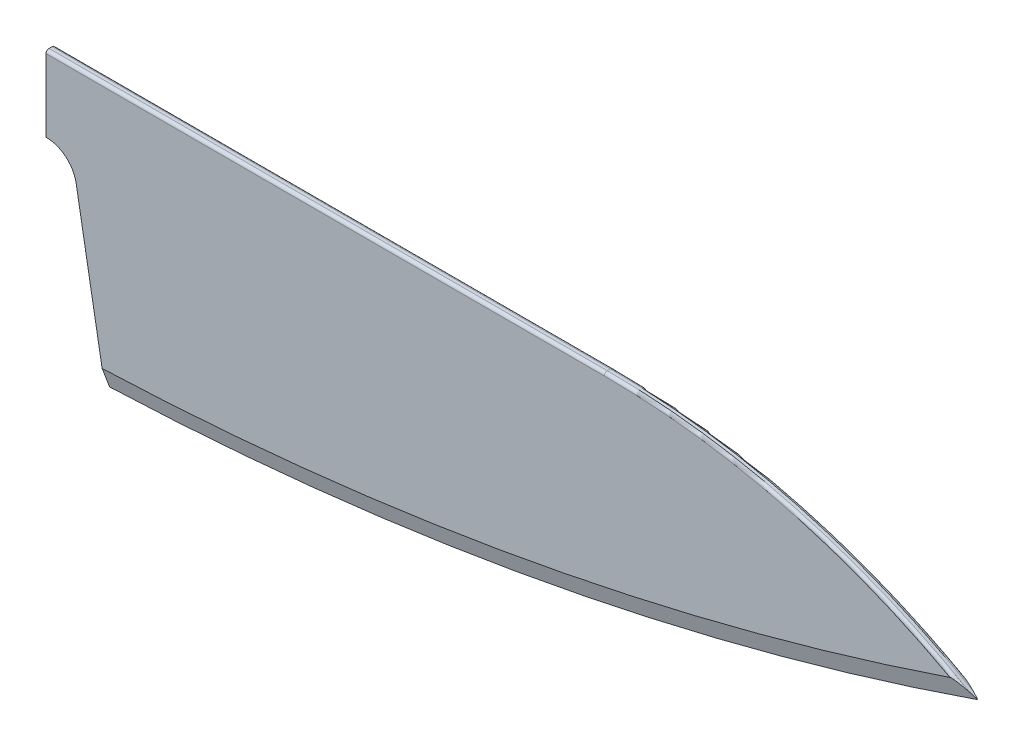
from build123d import *

# Parameters (mm, degrees)
BOSS_EXTRUDE1_DEPTH = 1.5
CHAMFER1_SIZE       = 8
CHAMFER1_SIZE_2     = 2.143593539
FILLET1_R           = 1


with BuildPart() as part:
    # Sketch1 → Boss-Extrude1 (new, symmetric)
    with BuildSketch(Plane.XY):
        with BuildLine():
            Line((180, -10), (365, -10))
            ThreePointArc((365, -10), (429.92024724, -18.947275501), (490, -45.121987515))
            ThreePointArc((490, -45.121987515), (347.035778042, -83.318956837), (200, -100))
            Line((200, -100), (189.995827472, -43.263518223))
            ThreePointArc((189.995827472, -43.263518223), (186.575626039, -37.339555569), (180.147749942, -35))
            Line((180.147749942, -35), (180, -35))
            Line((180, -35), (180, -10))
        make_face()
    extrude(amount=BOSS_EXTRUDE1_DEPTH, both=True)

    # Chamfer1
    # the kernel refuses this chamfer: 8, 2.143593539 mm, written as the material it takes off along each edge
    with BuildSketch(Plane(origin=(161.101103388, 899.243151511, -1.5), x_dir=(0.3484448247934172, -0.9373292932980836, 0), z_dir=(0.9373292932980836, 0.3484448247934172, 0))) as chamfer1_piece_1:
        Polygon((1000 - CHAMFER1_SIZE, 0), (1000, -CHAMFER1_SIZE_2), (1000, 0), align=None)
    revolve(axis=Axis((161.101103388, 899.243151511, -1.5), (0, 0, -1)), revolution_arc=19.353184564, mode=Mode.SUBTRACT)
    with BuildSketch(Plane(origin=(161.101103388, 899.243151511, 1.5), x_dir=(0.3484448247934172, -0.9373292932980836, 0), z_dir=(0.9373292932980836, 0.3484448247934172, 0))) as chamfer1_piece_2:
        Polygon((1000 - CHAMFER1_SIZE, 0), (1000, CHAMFER1_SIZE_2), (1000, 0), align=None)
    revolve(axis=Axis((161.101103388, 899.243151511, 1.5), (0, 0, -1)), revolution_arc=19.353184564, mode=Mode.SUBTRACT)

    # Fillet1
    fillet1_edges = [part.edges().sort_by_distance(p)[0] for p in [
        (424.811924688, -17.572519557, -1.5),
        (424.811924688, -17.572519557, 1.5),
        (272.5, -10, -1.5),
        (272.5, -10, 1.5),
    ]]
    fillet(fillet1_edges, radius=FILLET1_R)


solid = part.part
